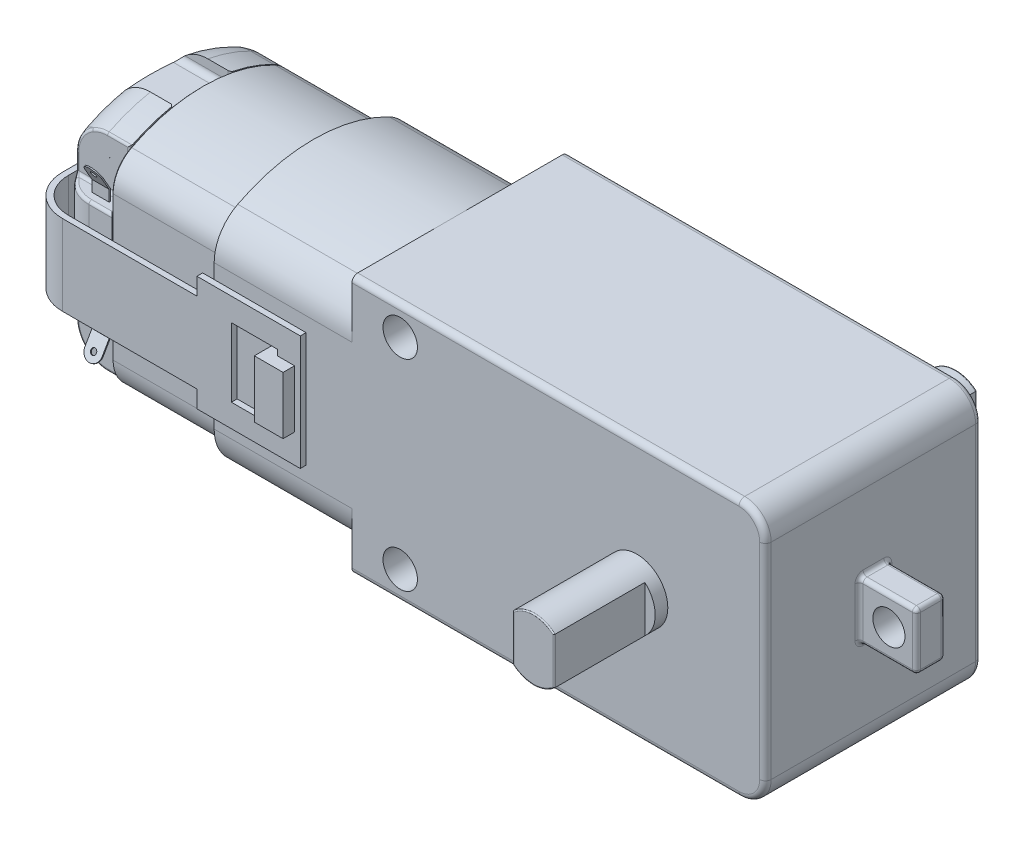
from build123d import *

# Parameters (mm, degrees)
SALIENTE_EXTRUIR1_DEPTH  = 9.4
REDONDEO1_R              = 0.5
CROQUIS2_R               = 2.7
SALIENTE_EXTRUIR2_DEPTH  = 9
CROQUIS3_W               = 0.9
CROQUIS3_H               = 4.02492236
CORTAR_EXTRUIR1_DEPTH    = 7.9
CROQUIS4_W               = 12
CROQUIS4_H               = 1.5
CORTAR_EXTRUIR2_DEPTH    = 57.114258438
REDONDEO3_R              = 0.5
CROQUIS5_R               = 1.5
CORTAR_EXTRUIR3_DEPTH    = 18.8
SALIENTE_EXTRUIR3_DEPTH  = 5
CROQUIS8_W               = 15.2
CROQUIS8_H               = 1.5
CROQUIS8_W_2             = 4
CROQUIS8_H_2             = 6
CORTAR_EXTRUIR4_DEPTH    = 57.11419161
SALIENTE_EXTRUIR4_DEPTH  = 2.5
SALIENTE_EXTRUIR5_DEPTH  = 14.7
CORTAR_EXTRUIR6_DEPTH    = 12
REDONDEO5_R              = 3
REDONDEO6_R              = 3.8
VACIADO1_START           = 18.5
VACIADO1_OUTLINE_W       = 20.9
VACIADO1_OUTLINE_H       = 17.2
VACIADO1_DEPTH           = 27.2
VACIADO1_2_DEPTH         = 13.9
VACIADO1_START_2         = 12.8
VACIADO1_3_DEPTH         = 1.1
VACIADO1_START_3         = -8.6
VACIADO1_4_DEPTH         = 17.2
REDONDEO7_R              = 3
CROQUIS12_R              = 3.75
SALIENTE_EXTRUIR6_DEPTH  = 1
CROQUIS13_R              = 0.95
SALIENTE_EXTRUIR7_DEPTH  = 1
CROQUIS14_R              = 4.25
SALIENTE_EXTRUIR8_DEPTH  = 0.5
CROQUIS15_R              = 1
CORTAR_EXTRUIR7_DEPTH    = 0.5
REDONDEO8_R              = 0.35
PARTIR4_SURFACE_1_BACK   = 78.76
PARTIR4_SURFACE_1_DEPTH  = 157.52
PARTIR4_SURFACE_2_BACK   = 78.76
PARTIR4_SURFACE_2_DEPTH  = 157.52
REDONDEO2_R              = 0.1
REDONDEO10_R             = 0.1
CROQUIS17_W              = 5
CROQUIS17_H              = 5
CROQUIS17_R              = 1.4
SALIENTE_EXTRUIR9_DEPTH  = 1.25
REDONDEO12_R             = 0.35
REDONDEO13_R             = 0.35
REDONDEO14_R             = 0.35
CORTAR_EXTRUIR8_DEPTH    = 5
REDONDEO17_R             = 0.25
CHAFL_N1_SIZE            = 0.1
SALIENTE_EXTRUIR10_DEPTH = 0.75
REDONDEO18_R             = 0.75
CROQUIS21_R              = 0.25
CORTAR_EXTRUIR9_DEPTH    = 1.5


with BuildPart() as part:
    # Croquis1 → Saliente-Extruir1 (new, symmetric)
    with BuildSketch(Plane.XY):
        with BuildLine():
            Line((45.7, 11.25), (0, 11.25))
            Line((0, 11.25), (0, -11.25))
            Line((0, -11.25), (45.7, -11.25))
            ThreePointArc((45.7, -11.25), (47.326345597, -10.576345597), (48, -8.95))
            Line((48, -8.95), (48, 8.95))
            ThreePointArc((48, 8.95), (47.326345597, 10.576345597), (45.7, 11.25))
        make_face()
    extrude(amount=SALIENTE_EXTRUIR1_DEPTH, both=True)

    # Redondeo1
    redondeo1_edges = [part.edges().sort_by_distance(p)[0] for p in [
        (47.326345597, -10.576345597, 9.4),
        (48, 0, 9.4),
        (47.326345597, 10.576345597, 9.4),
        (22.85, 11.25, 9.4),
        (22.85, 11.25, -9.4),
        (47.326345597, 10.576345597, -9.4),
        (48, 0, -9.4),
        (22.85, -11.25, 9.4),
        (47.326345597, -10.576345597, -9.4),
        (22.85, -11.25, -9.4),
    ]]
    fillet(redondeo1_edges, radius=REDONDEO1_R)

    # Croquis4 → Cortar-Extruir2 (cut, through all)
    with BuildSketch(Plane(origin=(0, 11.25, 0), x_dir=(1, 0, 0), z_dir=(0, 1, 0))):
        with Locations((6, 8.65)):
            Rectangle(CROQUIS4_W, CROQUIS4_H)
    extrude(amount=-CORTAR_EXTRUIR2_DEPTH, mode=Mode.SUBTRACT)

    # Redondeo3
    redondeo3_edges = [part.edges().sort_by_distance(p)[0] for p in [
        (6, 11.25, -7.9),
        (6, -11.25, -7.9),
    ]]
    fillet(redondeo3_edges, radius=REDONDEO3_R)

    # Croquis5 → Cortar-Extruir3 (cut)
    with BuildSketch(Plane(origin=(0, 0, -9.4), x_dir=(-1, 0, 0), z_dir=(0, 0, -1))):
        with Locations((-16.2, -8.75)):
            Circle(CROQUIS5_R)
        with Locations((-16.2, 8.75)):
            Circle(CROQUIS5_R)
    extrude(amount=-CORTAR_EXTRUIR3_DEPTH, mode=Mode.SUBTRACT)

    # Croquis9 → Saliente-Extruir4 (add, symmetric)
    with BuildSketch(Plane(origin=(0, 0, 0), x_dir=(1, 0, 0), z_dir=(0, 1, 0))):
        Polygon((6, 7.9), (6, 8.4), (7.5, 8.4), (7.5, 9.4), (5, 9.4), (5, 7.9), align=None)
        Polygon((5, -9.4), (6, -9.4), (6, -9.9), (7.5, -9.9), (7.5, -10.9), (5, -10.9), align=None)
    extrude(amount=SALIENTE_EXTRUIR4_DEPTH, both=True)

    # Croquis11 → Cortar-Extruir6 (cut)
    with BuildSketch(Plane.ZY):
        with BuildLine():
            Line((-7.9, 10.75), (-7.9, 8.356081442))
            ThreePointArc((-7.9, 8.356081442), (-3.810626748, 10.50733531), (0.749999958, 11.25))
            Line((0.749999958, 11.25), (-7.4, 11.25))
            ThreePointArc((-7.4, 11.25), (-7.753553391, 11.103553391), (-7.9, 10.75))
        make_face()
        with BuildLine():
            Line((8.9, 11.25), (0.749999958, 11.25))
            ThreePointArc((0.749999958, 11.25), (5.310626708, 10.507335323), (9.4, 8.356081442))
            Line((9.4, 8.356081442), (9.4, 10.75))
            ThreePointArc((9.4, 10.75), (9.253553391, 11.103553391), (8.9, 11.25))
        make_face()
        with BuildLine():
            ThreePointArc((0.75, -11.25), (-3.810626728, -10.507335316), (-7.9, -8.356081442))
            Line((-7.9, -8.356081442), (-7.9, -10.75))
            ThreePointArc((-7.9, -10.75), (-7.753553391, -11.103553391), (-7.4, -11.25))
            Line((-7.4, -11.25), (0.75, -11.25))
        make_face()
        with BuildLine():
            ThreePointArc((9.4, -8.356081442), (5.310626728, -10.507335316), (0.75, -11.25))
            Line((0.75, -11.25), (8.9, -11.25))
            ThreePointArc((8.9, -11.25), (9.253553391, -11.103553391), (9.4, -10.75))
            Line((9.4, -10.75), (9.4, -8.356081442))
        make_face()
    extrude(amount=-CORTAR_EXTRUIR6_DEPTH, mode=Mode.SUBTRACT)

    # Redondeo6
    redondeo6_edges = [part.edges().sort_by_distance(p)[0] for p in [
        (6, 8.356081442, 9.4),
        (6, 8.356081442, -7.9),
        (6, -8.356081442, 9.4),
        (6, -8.356081442, -7.9),
    ]]
    fillet(redondeo6_edges, radius=REDONDEO6_R)

    # Vaciado1: read off the stored shape, not the designer's step
    # Vaciado1 outline → Vaciado1 (cut)
    with BuildSketch(Plane.YZ.offset(VACIADO1_START)):
        Rectangle(VACIADO1_OUTLINE_W, VACIADO1_OUTLINE_H)
    extrude(amount=VACIADO1_DEPTH, mode=Mode.SUBTRACT)

    # Vaciado1 2 outline → Vaciado1 2 (cut)
    with BuildSketch(Plane.YZ):
        with BuildLine():
            ThreePointArc((8.938027809, -5.475951582), (10.45, 0.75), (8.938027809, 6.975951582))
            ThreePointArc((8.938027809, 6.975951582), (7.832969925, 8.162016271), (6.272177618, 8.6))
            Line((6.272177618, 8.6), (-6.272177618, 8.6))
            ThreePointArc((-6.272177618, 8.6), (-7.832969925, 8.162016271), (-8.938027809, 6.975951582))
            ThreePointArc((-8.938027809, 6.975951582), (-10.45, 0.75), (-8.938027809, -5.475951582))
            ThreePointArc((-8.938027809, -5.475951582), (-7.832969925, -6.662016271), (-6.272177618, -7.1))
            Line((-6.272177618, -7.1), (6.272177618, -7.1))
            ThreePointArc((6.272177618, -7.1), (7.832969925, -6.662016271), (8.938027809, -5.475951582))
        make_face()
    extrude(amount=VACIADO1_2_DEPTH, mode=Mode.SUBTRACT)

    # Vaciado1 3 outline → Vaciado1 3 (cut)
    with BuildSketch(Plane.YZ.offset(VACIADO1_START_2)):
        with BuildLine():
            Line((10.45, 0.75), (10.45, 8.6))
            Line((10.45, 8.6), (6.272177618, 8.6))
            ThreePointArc((6.272177618, 8.6), (7.832969925, 8.162016271), (8.938027809, 6.975951582))
            ThreePointArc((8.938027809, 6.975951582), (10.066592335, 3.953456454), (10.45, 0.75))
        make_face()
        with BuildLine():
            Line((10.45, -8.6), (10.45, 0.75))
            ThreePointArc((10.45, 0.75), (10.066592335, -2.453456454), (8.938027809, -5.475951582))
            ThreePointArc((8.938027809, -5.475951582), (7.832969925, -6.662016271), (6.272177618, -7.1))
            Line((6.272177618, -7.1), (-6.272177618, -7.1))
            ThreePointArc((-6.272177618, -7.1), (-7.832969925, -6.662016271), (-8.938027809, -5.475951582))
            ThreePointArc((-8.938027809, -5.475951582), (-10.066592335, -2.453456454), (-10.45, 0.75))
            Line((-10.45, 0.75), (-10.45, -8.6))
            Line((-10.45, -8.6), (10.45, -8.6))
        make_face()
        with BuildLine():
            ThreePointArc((-8.938027809, 6.975951582), (-7.832969925, 8.162016271), (-6.272177618, 8.6))
            Line((-6.272177618, 8.6), (-10.45, 8.6))
            Line((-10.45, 8.6), (-10.45, 0.75))
            ThreePointArc((-10.45, 0.75), (-10.066592335, 3.953456454), (-8.938027809, 6.975951582))
        make_face()
    extrude(amount=VACIADO1_3_DEPTH, mode=Mode.SUBTRACT)

    # Vaciado1 4 outline → Vaciado1 4 (cut)
    with BuildSketch(Plane.XY.offset(VACIADO1_START_3)):
        with BuildLine():
            ThreePointArc((14.650806662, -10.45), (14.096057905, -9.679208083), (13.9, -8.75))
            Line((13.9, -8.75), (13.9, -10.45))
            Line((13.9, -10.45), (14.650806662, -10.45))
        make_face()
        with BuildLine():
            ThreePointArc((18.5, 8.75), (16.2, 6.45), (13.9, 8.75))
            Line((13.9, 8.75), (13.9, -8.75))
            ThreePointArc((13.9, -8.75), (16.2, -6.45), (18.5, -8.75))
            Line((18.5, -8.75), (18.5, 8.75))
        make_face()
        with BuildLine():
            Line((14.650806662, 10.45), (13.9, 10.45))
            Line((13.9, 10.45), (13.9, 8.75))
            ThreePointArc((13.9, 8.75), (14.096057905, 9.679208083), (14.650806662, 10.45))
        make_face()
        with BuildLine():
            ThreePointArc((17.749193338, 10.45), (18.303942095, 9.679208083), (18.5, 8.75))
            Line((18.5, 8.75), (18.5, 10.45))
            Line((18.5, 10.45), (17.749193338, 10.45))
        make_face()
        with BuildLine():
            Line((18.5, -10.45), (18.5, -8.75))
            ThreePointArc((18.5, -8.75), (18.303942095, -9.679208083), (17.749193338, -10.45))
            Line((17.749193338, -10.45), (18.5, -10.45))
        make_face()
        with BuildLine():
            ThreePointArc((47.2, 8.95), (46.760660172, 10.010660172), (45.7, 10.45))
            Line((45.7, 10.45), (45.7, -10.45))
            ThreePointArc((45.7, -10.45), (46.760660172, -10.010660172), (47.2, -8.95))
            Line((47.2, -8.95), (47.2, 8.95))
        make_face()
    extrude(amount=VACIADO1_4_DEPTH, mode=Mode.SUBTRACT)

    # Croquis17 → Saliente-Extruir9 (add, symmetric)
    with BuildSketch(Plane.XY):
        with Locations((50.5, 0)):
            Rectangle(CROQUIS17_W, CROQUIS17_H)
        with Locations((50.6, 0)):
            Circle(CROQUIS17_R, mode=Mode.SUBTRACT)
    extrude(amount=SALIENTE_EXTRUIR9_DEPTH, both=True)

    # Redondeo12
    redondeo12_edges = [part.edges().sort_by_distance(p)[0] for p in [
        (53, -2.5, 0),
        (53, 2.5, 0),
    ]]
    fillet(redondeo12_edges, radius=REDONDEO12_R)

    # Redondeo13
    redondeo13_edges = [part.edges().sort_by_distance(p)[0] for p in [
        (50.325, -2.5, 1.25),
        (50.325, -2.5, -1.25),
        (53, 0, -1.25),
        (53, 0, 1.25),
        (50.325, 2.5, -1.25),
        (52.897487373, 2.397487373, -1.25),
        (52.897487373, -2.397487373, -1.25),
        (50.325, 2.5, 1.25),
        (52.897487373, 2.397487373, 1.25),
        (52.897487373, -2.397487373, 1.25),
    ]]
    fillet(redondeo13_edges, radius=REDONDEO13_R)

    # Redondeo14
    redondeo14_edges = [part.edges().sort_by_distance(p)[0] for p in [
        (48, -2.5, 0),
        (48, 0, -1.25),
        (48, 0, 1.25),
        (48, 2.5, 0),
        (48, -2.397487373, -1.147487373),
        (48, -2.397487373, 1.147487373),
        (48, 2.397487373, -1.147487373),
        (48, 2.397487373, 1.147487373),
    ]]
    fillet(redondeo14_edges, radius=REDONDEO14_R)


with BuildPart() as body_2:
    # Croquis2 → Saliente-Extruir2 (new body)
    with BuildSketch(Plane.XY.offset(9.4)):
        with Locations((36.8, 0)):
            Circle(CROQUIS2_R)
    extrude(amount=SALIENTE_EXTRUIR2_DEPTH)

    # Croquis3 → Cortar-Extruir1 (cut)
    with BuildSketch(Plane.XY.offset(18.4)):
        with Locations((34.55, 0)):
            Rectangle(CROQUIS3_W, CROQUIS3_H)
        with Locations((39.05, 0)):
            Rectangle(CROQUIS3_W, CROQUIS3_H)
    extrude(amount=-CORTAR_EXTRUIR1_DEPTH, mode=Mode.SUBTRACT)


with BuildPart() as body_3:
    # Simetría1: mirrored copy
    add(body_2.part.mirror(Plane.XY))

    # Redondeo10
    redondeo10_edges = [body_3.edges().sort_by_distance(p)[0] for p in [
        (36.8, 2.7, -18.4),
        (38.6, 0, -18.4),
        (36.8, -2.7, -18.4),
        (35, 0, -18.4),
    ]]
    fillet(redondeo10_edges, radius=REDONDEO10_R)


with BuildPart() as body_4:
    # Croquis7 → Saliente-Extruir3 (new, symmetric)
    with BuildSketch(Plane(origin=(0, 0, 0), x_dir=(1, 0, 0), z_dir=(0, 1, 0))):
        with BuildLine():
            Line((8, 7.9), (-12.7, 7.9))
            ThreePointArc((-12.7, 7.9), (-14.821320344, 7.021320344), (-15.7, 4.9))
            Line((-15.7, 4.9), (-15.7, -6.4))
            ThreePointArc((-15.7, -6.4), (-14.821320344, -8.521320344), (-12.7, -9.4))
            Line((-12.7, -9.4), (8, -9.4))
            Line((8, -9.4), (8, -9.9))
            Line((8, -9.9), (-12.7, -9.9))
            ThreePointArc((-12.7, -9.9), (-15.174873734, -8.874873734), (-16.2, -6.4))
            Line((-16.2, -6.4), (-16.2, 4.9))
            ThreePointArc((-16.2, 4.9), (-15.174873734, 7.374873734), (-12.7, 8.4))
            Line((-12.7, 8.4), (8, 8.4))
            Line((8, 8.4), (8, 7.9))
        make_face()
    extrude(amount=SALIENTE_EXTRUIR3_DEPTH, both=True)

    # Croquis8 → Cortar-Extruir4 (cut, through all)
    with BuildSketch(Plane(origin=(0, 0, -8.4), x_dir=(-1, 0, 0), z_dir=(0, 0, -1))):
        with Locations((8.6, 4.25)):
            Rectangle(CROQUIS8_W, CROQUIS8_H)
        with Locations((8.6, -4.25)):
            Rectangle(CROQUIS8_W, CROQUIS8_H)
        with Locations((-4, 0)):
            Rectangle(CROQUIS8_W_2, CROQUIS8_H_2)
    extrude(amount=-CORTAR_EXTRUIR4_DEPTH, mode=Mode.SUBTRACT)

    # Croquis14 → Saliente-Extruir8 (add)
    with BuildSketch(Plane.ZY.offset(16.2)):
        with Locations((0.75, 0)):
            Circle(CROQUIS14_R)
    extrude(amount=-SALIENTE_EXTRUIR8_DEPTH)

    # Croquis15 → Cortar-Extruir7 (cut)
    with BuildSketch(Plane.ZY.offset(16.2)):
        with Locations((0.75, 0)):
            Circle(CROQUIS15_R)
    extrude(amount=-CORTAR_EXTRUIR7_DEPTH, mode=Mode.SUBTRACT)


with BuildPart() as body_5:
    # Croquis10 → Saliente-Extruir5 (new body)
    with BuildSketch(Plane.ZY):
        with BuildLine():
            Line((-7.1, 7.95), (-7.1, -7.95))
            ThreePointArc((-7.1, -7.95), (0.75, -10.45), (8.6, -7.95))
            Line((8.6, -7.95), (8.6, 7.95))
            ThreePointArc((8.6, 7.95), (0.75, 10.45), (-7.1, 7.95))
        make_face()
    extrude(amount=SALIENTE_EXTRUIR5_DEPTH)

    # Redondeo5
    redondeo5_edges = [body_5.edges().sort_by_distance(p)[0] for p in [
        (-7.35, 7.95, -7.1),
        (-7.35, -7.95, -7.1),
        (-7.35, -7.95, 8.6),
        (-7.35, 7.95, 8.6),
    ]]
    fillet(redondeo5_edges, radius=REDONDEO5_R)

    # Redondeo7
    redondeo7_edges = [body_5.edges().sort_by_distance(p)[0] for p in [
        (-14.7, 0, -7.1),
        (-14.7, 10.45, 0.75),
        (-14.7, 0, 8.6),
        (-14.7, -10.45, 0.75),
        (-14.7, 7.832969925, 8.162016271),
        (-14.7, -7.832969925, 8.162016271),
        (-14.7, -7.832969925, -6.662016271),
        (-14.7, 7.832969925, -6.662016271),
    ]]
    fillet(redondeo7_edges, radius=REDONDEO7_R)

    # Croquis12 → Saliente-Extruir6 (add)
    with BuildSketch(Plane.ZY.offset(14.7)):
        with Locations((0.75, 0)):
            Circle(CROQUIS12_R)
    extrude(amount=SALIENTE_EXTRUIR6_DEPTH)


with BuildPart() as body_6:
    # Croquis13 → Saliente-Extruir7 (new body)
    with BuildSketch(Plane.ZY.offset(15.7)):
        with Locations((0.75, 0)):
            Circle(CROQUIS13_R)
    extrude(amount=SALIENTE_EXTRUIR7_DEPTH)

    # Redondeo8
    redondeo8_edges = [body_6.edges().sort_by_distance(p)[0] for p in [
        (-16.7, 0, -0.2),
    ]]
    fillet(redondeo8_edges, radius=REDONDEO8_R)


with BuildPart() as body_7:
    # Partir4: the piece behind the surface
    add(body_5.part)
    # Partir4 surface: a surface, the sketch's curves swept straight by 157.52 mm
    with BuildLine(Plane(origin=(0, 0, 0), x_dir=(1, 0, 0), z_dir=(0, 1, 0)).offset(-PARTIR4_SURFACE_1_BACK), mode=Mode.PRIVATE) as partir4_surface_1_path:
        Line((-9.7, 7.1), (-9.7, -8.6))
    partir4_surface_1 = Shell.extrude(partir4_surface_1_path.wire(), (0 * PARTIR4_SURFACE_1_DEPTH, 1 * PARTIR4_SURFACE_1_DEPTH, 0 * PARTIR4_SURFACE_1_DEPTH))
    split(bisect_by=partir4_surface_1, keep=Keep.BOTTOM)

    # Croquis18 → Cortar-Extruir8 (cut)
    with BuildSketch(Plane.ZY.offset(14.7)):
        with BuildLine():
            Line((-1.75, 10.217803034), (-1.75, 9.45))
            ThreePointArc((-1.75, 9.45), (-1.603553391, 9.096446609), (-1.25, 8.95))
            Line((-1.25, 8.95), (2.75, 8.95))
            ThreePointArc((2.75, 8.95), (3.103553391, 9.096446609), (3.25, 9.45))
            Line((3.25, 9.45), (3.25, 10.217803034))
            ThreePointArc((3.25, 10.217803034), (0.75, 10.45), (-1.75, 10.217803034))
        make_face()
        with BuildLine():
            Line((-1.25, -8.95), (2.75, -8.95))
            ThreePointArc((2.75, -8.95), (3.103553391, -9.096446609), (3.25, -9.45))
            Line((3.25, -9.45), (3.25, -10.217803034))
            ThreePointArc((3.25, -10.217803034), (0.75, -10.45), (-1.75, -10.217803034))
            Line((-1.75, -10.217803034), (-1.75, -9.45))
            ThreePointArc((-1.75, -9.45), (-1.603553391, -9.096446609), (-1.25, -8.95))
        make_face()
        with BuildLine():
            Line((6.975951582, 6.272177618), (6.975951582, 8.938027809))
            ThreePointArc((6.975951582, 8.938027809), (8.162016271, 7.832969925), (8.6, 6.272177618))
            Line((8.6, 6.272177618), (8.6, 4.648129199))
            Line((8.6, 4.648129199), (6.975951582, 4.648129199))
            Line((6.975951582, 4.648129199), (6.975951582, 6.272177618))
        make_face()
        with BuildLine():
            Line((6.975951582, -8.938027809), (6.975951582, -6.272177618))
            Line((6.975951582, -6.272177618), (6.975951582, -4.648129199))
            Line((6.975951582, -4.648129199), (8.6, -4.648129199))
            Line((8.6, -4.648129199), (8.6, -6.272177618))
            ThreePointArc((8.6, -6.272177618), (8.162016271, -7.832969925), (6.975951582, -8.938027809))
        make_face()
    extrude(amount=-CORTAR_EXTRUIR8_DEPTH, mode=Mode.SUBTRACT)

    # Redondeo17
    redondeo17_edges = [body_7.edges().sort_by_distance(p)[0] for p in [
        (-9.7, 8.95, 0.75),
        (-9.7, 9.096446609, -1.603553391),
        (-9.7, 9.833901517, -1.75),
        (-9.7, 9.833901517, 3.25),
        (-9.7, 9.096446609, 3.103553391),
        (-13.585040748, 8.157218366, 6.975951582),
        (-13.260792308, 4.648129199, 8.162016271),
        (-9.7, 4.648129199, 7.787975791),
        (-10.7, 4.648129199, 8.6),
        (-12.032925096, 4.648129199, 6.975951582),
        (-14.365850192, 5.460153408, 6.975951582),
        (-9.7, 6.793078504, 6.975951582),
        (-13.260792308, -4.648129199, 8.162016271),
        (-14.365850192, -5.460153408, 6.975951582),
        (-10.7, -4.648129199, 8.6),
        (-13.585040748, -8.157218366, 6.975951582),
        (-12.032925096, -4.648129199, 6.975951582),
        (-9.7, -6.793078504, 6.975951582),
        (-9.7, -4.648129199, 7.787975791),
        (-9.7, -9.833901517, -1.75),
        (-9.7, -9.096446609, -1.603553391),
        (-9.7, -8.95, 0.75),
        (-9.7, -9.096446609, 3.103553391),
        (-9.7, -9.833901517, 3.25),
        (-10.7, 8.938027809, 6.975951582),
        (-10.7, -8.938027809, 6.975951582),
    ]]
    fillet(redondeo17_edges, radius=REDONDEO17_R)


with BuildPart() as body_5_1:
    add(body_5.part)

    # Partir4: split by a surface, the side it looks to stays
    # Partir4 surface: a surface, the sketch's curves swept straight by 157.52 mm
    with BuildLine(Plane(origin=(0, 0, 0), x_dir=(1, 0, 0), z_dir=(0, 1, 0)).offset(-PARTIR4_SURFACE_2_BACK), mode=Mode.PRIVATE) as partir4_surface_2_path:
        Line((-9.7, 7.1), (-9.7, -8.6))
    partir4_surface_2 = Shell.extrude(partir4_surface_2_path.wire(), (0 * PARTIR4_SURFACE_2_DEPTH, 1 * PARTIR4_SURFACE_2_DEPTH, 0 * PARTIR4_SURFACE_2_DEPTH))
    split(bisect_by=partir4_surface_2, keep=Keep.TOP)

    # Chaflán1
    chafl_n1_edges = [body_5_1.edges().sort_by_distance(p)[0] for p in [
        (-9.7, 7.832969925, 8.162016271),
        (-9.7, -7.832969925, 8.162016271),
        (-9.7, -7.832969925, -6.662016271),
        (-9.7, 7.832969925, -6.662016271),
        (-9.7, 10.45, 0.75),
        (-9.7, 0, -7.1),
        (-9.7, -10.45, 0.75),
        (-9.7, 0, 8.6),
    ]]
    chamfer(chafl_n1_edges, length=CHAFL_N1_SIZE)


with BuildPart() as body_2_1:
    add(body_2.part)

    # Redondeo2
    redondeo2_edges = [body_2_1.edges().sort_by_distance(p)[0] for p in [
        (36.8, 2.7, 18.4),
        (38.6, 0, 18.4),
        (36.8, -2.7, 18.4),
        (35, 0, 18.4),
    ]]
    fillet(redondeo2_edges, radius=REDONDEO2_R)


with BuildPart() as body_8:
    # Croquis19 → Saliente-Extruir10 (new, symmetric)
    with BuildSketch(Plane(origin=(-11.5, 0, 0), x_dir=(0, 0, -1), z_dir=(1, 0, 0))):
        Polygon((-7.787975791, 4.648129199), (-7.787975791, 5.62133428), (-8.774578331, 7.330180007), (-8.687975791, 7.380180007), (-7.687975791, 5.648129199), (-7.687975791, 4.648129199), align=None)
    extrude(amount=SALIENTE_EXTRUIR10_DEPTH, both=True)

    # Redondeo18
    redondeo18_edges = [body_8.edges().sort_by_distance(p)[0] for p in [
        (-10.75, 7.355180007, 8.731277061),
        (-12.25, 7.355180007, 8.731277061),
    ]]
    fillet(redondeo18_edges, radius=REDONDEO18_R - 0.0001)  # a hair under: the kernel refuses the full size


with BuildPart() as cortar_extruir9_tool:
    # Croquis21 → Cortar-Extruir9 (new body)
    with BuildSketch(Plane(origin=(0, -1.966958869, 3.406872698), x_dir=(1, 0, 0), z_dir=(0, -0.5000000000000014, 0.8660254037844379))):
        with Locations(Location((-11.5, 9.985411266, 0), (0, 0, 270))):
            Circle(CROQUIS21_R)
    extrude(amount=-CORTAR_EXTRUIR9_DEPTH)


with BuildPart() as body_7_1:
    add(body_7.part)

    # Cortar-Extruir9: cut by cortar_extruir9_tool
    add(cortar_extruir9_tool.part, mode=Mode.SUBTRACT)


with BuildPart() as body_8_1:
    add(body_8.part)

    # Cortar-Extruir9: cut by cortar_extruir9_tool
    add(cortar_extruir9_tool.part, mode=Mode.SUBTRACT)


with BuildPart() as body_9:
    # Simetría2: mirrored copy
    add(body_8_1.part.mirror(Plane.ZX))


solid = Compound([part.part, body_3.part, body_4.part, body_6.part, body_5_1.part, body_2_1.part, body_7_1.part, body_8_1.part, body_9.part])
